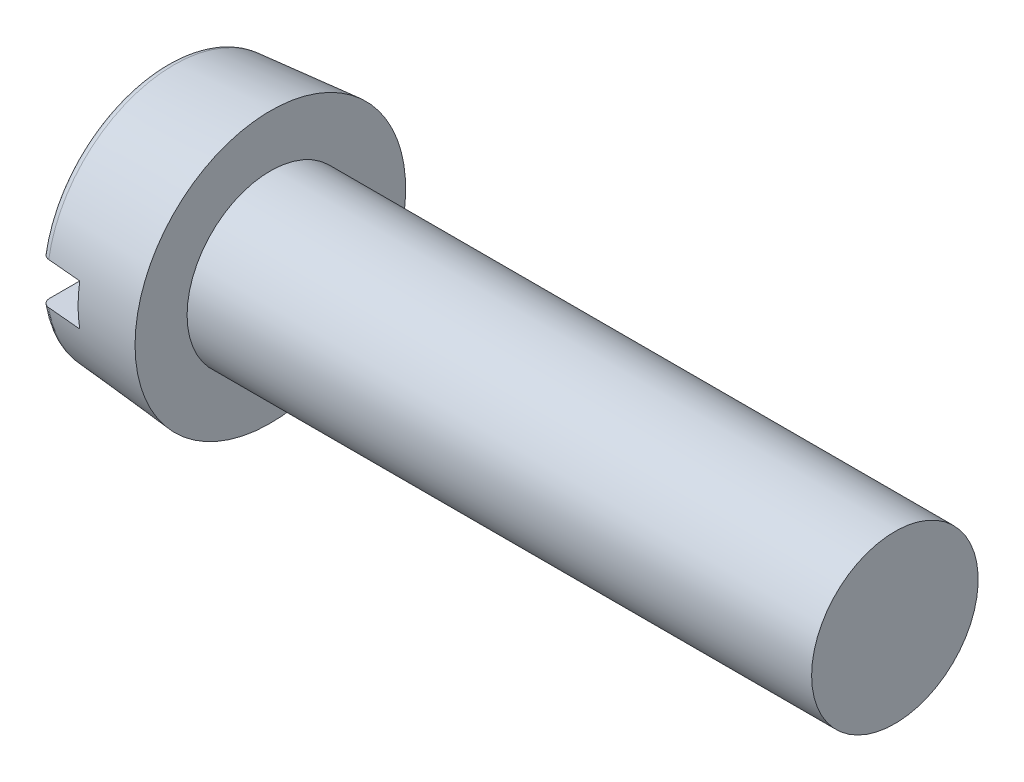
from build123d import *

# Parameters (mm, degrees)
SKETCH2_W  = 13
SKETCH2_H  = 2
SLOT_DEPTH = 2


with BuildPart() as part:
    # Fillet2: read off the stored shape, not the designer's step
    # Fillet2 outline → Fillet2 (revolve)
    with BuildSketch(Plane.YX):
        with BuildLine():
            Line((4, 5), (4, 35))
            Line((4, 35), (0, 35))
            Line((0, 35), (0, 0))
            Line((0, 0), (5.696024213, 0))
            ThreePointArc((5.696024213, 0), (5.966260296, 0.105089065), (6.094502092, 0.365137703))
            Line((6.094502092, 0.365137703), (6.5, 5))
            Line((6.5, 5), (4, 5))
        make_face()
    revolve(axis=Axis((0, 0, 0), (1, 0, 0)))

    # Sketch2 → Slot (cut)
    with BuildSketch(Plane(origin=(0, 0, 0), x_dir=(0, 0, -1), z_dir=(1, 0, 0))):
        Rectangle(SKETCH2_W, SKETCH2_H)
    extrude(amount=SLOT_DEPTH, mode=Mode.SUBTRACT)


solid = part.part
